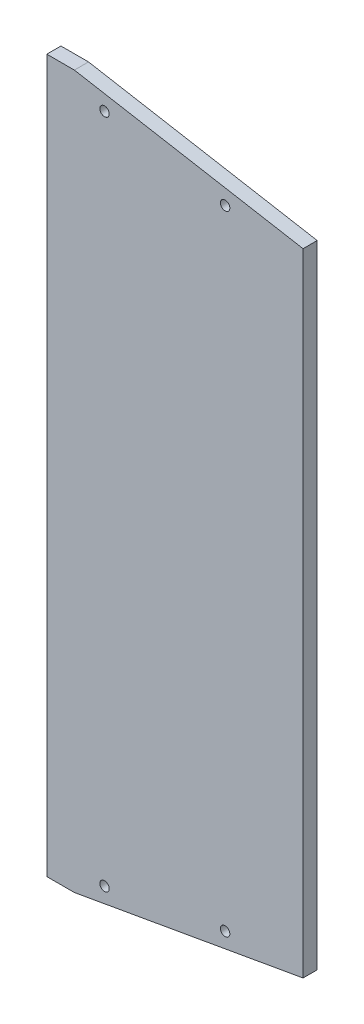
from build123d import *

# Parameters (mm, degrees)
BOSS_EXTRUDE1_DEPTH            = 11.90625
F_5_16_0_3125_DIAMETER_HOLE1_D = 7.9375


with BuildPart() as part:
    # Sketch1 → Boss-Extrude1 (new body)
    with BuildSketch(Plane.XY):
        Polygon((151.023557582, 152.540387465), (-41.644064035, 186.512887465), (-64.876442418, 186.512887465), (-64.876442418, -413.562112535), (-41.644064035, -413.562112535), (151.023557582, -379.589612535), align=None)
    extrude(amount=BOSS_EXTRUDE1_DEPTH)

    # 5/16 (0.3125) Diameter Hole1 (through all)
    with Locations(Plane.XY.offset(11.90625)):
        with Locations((85.355935965, 151.223442944), (-16.244064035, 169.138264184), (-16.244064035, -396.187489254), (85.355935965, -378.272668014)):
            Hole(F_5_16_0_3125_DIAMETER_HOLE1_D / 2)


solid = part.part
